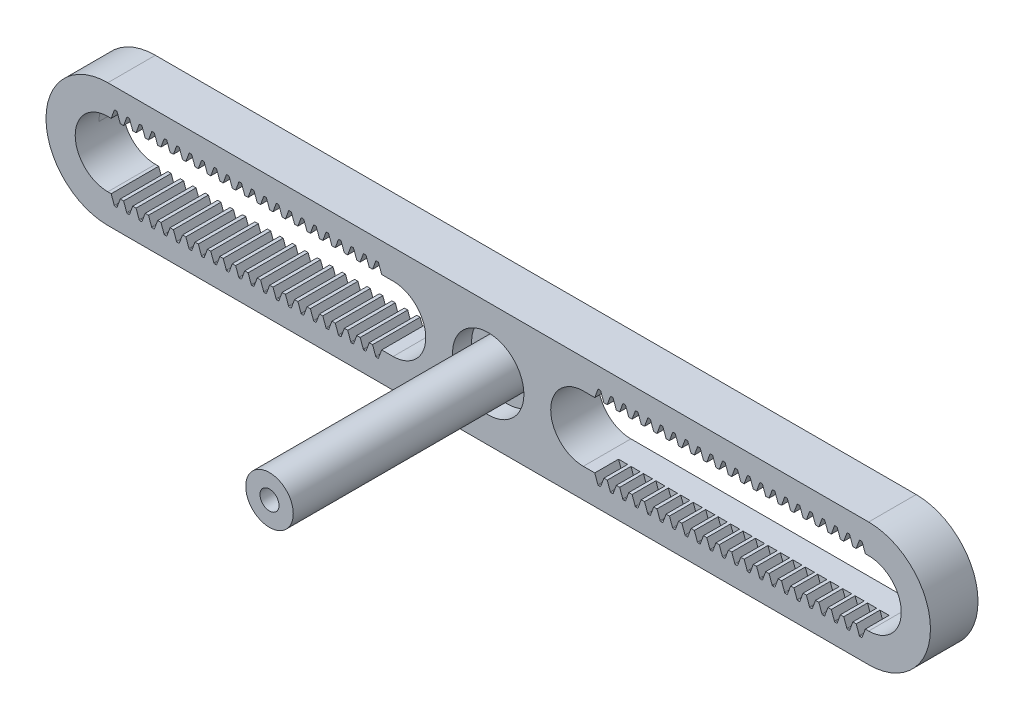
from build123d import *

# Parameters (mm, degrees)
BOSS_EXTRUDE1_DEPTH    = 3.175
SKETCH2_R              = 1.27
CUT_EXTRUDE1_DEPTH     = 50.8
CUT_EXTRUDE2_REACH     = 61.714
FILLET1_R              = 0.09960102
LPATTERN1_COUNT        = 22
LPATTERN1_PITCH        = 1.662439883
FILLET1_OF_LPATTERN1_R = 0.09960102
MIRROR4_DEPTH          = 3.175
MIRROR1_DEPTH          = 3.175
MIRROR2_START          = -3.175
MIRROR2_DEPTH          = 3.175
CUT_EXTRUDE3_DEPTH     = 3.175
MIRROR5_DEPTH          = 3.175
SKETCH6_R              = 4.7625
CUT_EXTRUDE4_DEPTH     = 2.54
BOSS_EXTRUDE2_START    = 31.75
SKETCH7_R              = 3.175
SKETCH7_R_2            = 1.27
BOSS_EXTRUDE2_DEPTH    = 31.75


# Read off the part's stored shape, not the designer's step: Mirror4, Mirror1, Mirror2, Mirror5
with BuildPart() as part:
    # Sketch1 → Boss-Extrude1 (new, symmetric)
    with BuildSketch(Plane.XY):
        with BuildLine():
            Line((-50.8, 8.255), (50.8, 8.255))
            ThreePointArc((50.8, 8.255), (59.055, 0), (50.8, -8.255))
            Line((50.8, -8.255), (-50.8, -8.255))
            ThreePointArc((-50.8, -8.255), (-59.055, 0), (-50.8, 8.255))
        make_face()
    extrude(amount=BOSS_EXTRUDE1_DEPTH, both=True)

    # Sketch2 → Cut-Extrude1 (cut)
    with BuildSketch(Plane.XY.offset(3.175)):
        Circle(SKETCH2_R)
        with BuildLine():
            Line((-50.8, 4.3561), (-12.7, 4.3561))
            ThreePointArc((-12.7, 4.3561), (-8.3439, 0), (-12.7, -4.3561))
            Line((-12.7, -4.3561), (-50.8, -4.3561))
            ThreePointArc((-50.8, -4.3561), (-55.1561, 0), (-50.8, 4.3561))
        make_face()
        with BuildLine():
            Line((50.8, 4.3561), (12.7, 4.3561))
            ThreePointArc((12.7, 4.3561), (8.3439, 0), (12.7, -4.3561))
            Line((12.7, -4.3561), (50.8, -4.3561))
            ThreePointArc((50.8, -4.3561), (55.1561, 0), (50.8, 4.3561))
        make_face()
    extrude(amount=-CUT_EXTRUDE1_DEPTH, mode=Mode.SUBTRACT)

    # Sketch3 → Cut-Extrude2 (cut, up to next)
    with BuildSketch(Plane.XY, mode=Mode.PRIVATE) as cut_extrude2_sk1:
        Polygon((-50.353986922, -4.3561), (-49.91177522, -5.571066667), (-49.57977182, -5.571066667), (-49.137560117, -4.3561), align=None)
    cut_extrude2_tool1 = extrude(cut_extrude2_sk1.sketch, amount=CUT_EXTRUDE2_REACH, mode=Mode.PRIVATE) & part.part
    cut_extrude2 = cut_extrude2_tool1.solids().sort_by_distance((-49.745774, -4.847924, 0))[0]
    add(cut_extrude2, mode=Mode.SUBTRACT)

    # Fillet1
    fillet1_edges = [part.edges().sort_by_distance(p)[0] for p in [
        (-49.91177522, -5.571066667, 1.5875),
        (-49.57977182, -5.571066667, 1.5875),
    ]]
    fillet(fillet1_edges, radius=FILLET1_R)

    # LPattern1: Cut-Extrude2 ×22
    with Locations(*[(i * LPATTERN1_PITCH, 0, 0) for i in range(1, LPATTERN1_COUNT)]):
        add(cut_extrude2, mode=Mode.SUBTRACT)

    # Fillet1 of LPattern1
    fillet1_of_lpattern1_edges = [part.edges().sort_by_distance(p)[0] for p in [
        (-48.249335337, -5.571066667, 1.5875),
        (-47.917331937, -5.571066667, 1.5875),
        (-46.586895455, -5.571066667, 1.5875),
        (-46.254892055, -5.571066667, 1.5875),
        (-44.924455572, -5.571066667, 1.5875),
        (-44.592452172, -5.571066667, 1.5875),
        (-43.262015689, -5.571066667, 1.5875),
        (-42.930012289, -5.571066667, 1.5875),
        (-41.599575807, -5.571066667, 1.5875),
        (-41.267572407, -5.571066667, 1.5875),
        (-39.937135924, -5.571066667, 1.5875),
        (-39.605132524, -5.571066667, 1.5875),
        (-38.274696042, -5.571066667, 1.5875),
        (-37.942692642, -5.571066667, 1.5875),
        (-36.612256159, -5.571066667, 1.5875),
        (-36.280252759, -5.571066667, 1.5875),
        (-34.949816276, -5.571066667, 1.5875),
        (-34.617812876, -5.571066667, 1.5875),
        (-33.287376394, -5.571066667, 1.5875),
        (-32.955372994, -5.571066667, 1.5875),
        (-31.624936511, -5.571066667, 1.5875),
        (-31.292933111, -5.571066667, 1.5875),
        (-29.962496629, -5.571066667, 1.5875),
        (-29.630493229, -5.571066667, 1.5875),
        (-28.300056746, -5.571066667, 1.5875),
        (-27.968053346, -5.571066667, 1.5875),
        (-26.637616864, -5.571066667, 1.5875),
        (-26.305613464, -5.571066667, 1.5875),
        (-24.975176981, -5.571066667, 1.5875),
        (-24.643173581, -5.571066667, 1.5875),
        (-23.312737098, -5.571066667, 1.5875),
        (-22.980733698, -5.571066667, 1.5875),
        (-21.650297216, -5.571066667, 1.5875),
        (-21.318293816, -5.571066667, 1.5875),
        (-19.987857333, -5.571066667, 1.5875),
        (-19.655853933, -5.571066667, 1.5875),
        (-18.325417451, -5.571066667, 1.5875),
        (-17.993414051, -5.571066667, 1.5875),
        (-16.662977568, -5.571066667, 1.5875),
        (-16.330974168, -5.571066667, 1.5875),
        (-15.000537685, -5.571066667, 1.5875),
        (-14.668534285, -5.571066667, 1.5875),
    ]]
    fillet(fillet1_of_lpattern1_edges, radius=FILLET1_OF_LPATTERN1_R)

    # Mirror4 outline → Mirror4 (cut)
    with BuildSketch(Plane.XY):
        with BuildLine():
            ThreePointArc((14.644681327, -5.505531202), (14.681146872, -5.553054026), (14.73827567, -5.571066667))
            Line((14.73827567, -5.571066667), (14.9307963, -5.571066667))
            ThreePointArc((14.9307963, -5.571066667), (14.987925099, -5.553054026), (15.024390644, -5.505531202))
            Line((15.024390644, -5.505531202), (15.442749388, -4.3561))
            Line((15.442749388, -4.3561), (14.226322583, -4.3561))
            Line((14.226322583, -4.3561), (14.644681327, -5.505531202))
        make_face()
        with BuildLine():
            Line((50.353986922, -4.3561), (49.137560117, -4.3561))
            Line((49.137560117, -4.3561), (49.555918861, -5.505531202))
            ThreePointArc((49.555918861, -5.505531202), (49.592384407, -5.553054026), (49.649513205, -5.571066667))
            Line((49.649513205, -5.571066667), (49.842033835, -5.571066667))
            ThreePointArc((49.842033835, -5.571066667), (49.899162633, -5.553054026), (49.935628178, -5.505531202))
            Line((49.935628178, -5.505531202), (50.353986922, -4.3561))
        make_face()
        with BuildLine():
            Line((48.691547039, -4.3561), (47.475120235, -4.3561))
            Line((47.475120235, -4.3561), (47.893478979, -5.505531202))
            ThreePointArc((47.893478979, -5.505531202), (47.929944524, -5.553054026), (47.987073322, -5.571066667))
            Line((47.987073322, -5.571066667), (48.179593952, -5.571066667))
            ThreePointArc((48.179593952, -5.571066667), (48.23672275, -5.553054026), (48.273188296, -5.505531202))
            Line((48.273188296, -5.505531202), (48.691547039, -4.3561))
        make_face()
        with BuildLine():
            Line((47.029107157, -4.3561), (45.812680352, -4.3561))
            Line((45.812680352, -4.3561), (46.231039096, -5.505531202))
            ThreePointArc((46.231039096, -5.505531202), (46.267504641, -5.553054026), (46.32463344, -5.571066667))
            Line((46.32463344, -5.571066667), (46.51715407, -5.571066667))
            ThreePointArc((46.51715407, -5.571066667), (46.574282868, -5.553054026), (46.610748413, -5.505531202))
            Line((46.610748413, -5.505531202), (47.029107157, -4.3561))
        make_face()
        with BuildLine():
            Line((45.366667274, -4.3561), (44.15024047, -4.3561))
            Line((44.15024047, -4.3561), (44.568599213, -5.505531202))
            ThreePointArc((44.568599213, -5.505531202), (44.605064759, -5.553054026), (44.662193557, -5.571066667))
            Line((44.662193557, -5.571066667), (44.854714187, -5.571066667))
            ThreePointArc((44.854714187, -5.571066667), (44.911842985, -5.553054026), (44.94830853, -5.505531202))
            Line((44.94830853, -5.505531202), (45.366667274, -4.3561))
        make_face()
        with BuildLine():
            Line((43.704227392, -4.3561), (42.487800587, -4.3561))
            Line((42.487800587, -4.3561), (42.906159331, -5.505531202))
            ThreePointArc((42.906159331, -5.505531202), (42.942624876, -5.553054026), (42.999753674, -5.571066667))
            Line((42.999753674, -5.571066667), (43.192274304, -5.571066667))
            ThreePointArc((43.192274304, -5.571066667), (43.249403102, -5.553054026), (43.285868648, -5.505531202))
            Line((43.285868648, -5.505531202), (43.704227392, -4.3561))
        make_face()
        with BuildLine():
            Line((42.041787509, -4.3561), (40.825360704, -4.3561))
            Line((40.825360704, -4.3561), (41.243719448, -5.505531202))
            ThreePointArc((41.243719448, -5.505531202), (41.280184994, -5.553054026), (41.337313792, -5.571066667))
            Line((41.337313792, -5.571066667), (41.529834422, -5.571066667))
            ThreePointArc((41.529834422, -5.571066667), (41.58696322, -5.553054026), (41.623428765, -5.505531202))
            Line((41.623428765, -5.505531202), (42.041787509, -4.3561))
        make_face()
        with BuildLine():
            Line((40.379347626, -4.3561), (39.162920822, -4.3561))
            Line((39.162920822, -4.3561), (39.581279566, -5.505531202))
            ThreePointArc((39.581279566, -5.505531202), (39.617745111, -5.553054026), (39.674873909, -5.571066667))
            Line((39.674873909, -5.571066667), (39.867394539, -5.571066667))
            ThreePointArc((39.867394539, -5.571066667), (39.924523337, -5.553054026), (39.960988883, -5.505531202))
            Line((39.960988883, -5.505531202), (40.379347626, -4.3561))
        make_face()
        with BuildLine():
            Line((38.716907744, -4.3561), (37.500480939, -4.3561))
            Line((37.500480939, -4.3561), (37.918839683, -5.505531202))
            ThreePointArc((37.918839683, -5.505531202), (37.955305229, -5.553054026), (38.012434027, -5.571066667))
            Line((38.012434027, -5.571066667), (38.204954657, -5.571066667))
            ThreePointArc((38.204954657, -5.571066667), (38.262083455, -5.553054026), (38.298549, -5.505531202))
            Line((38.298549, -5.505531202), (38.716907744, -4.3561))
        make_face()
        with BuildLine():
            Line((37.054467861, -4.3561), (35.838041057, -4.3561))
            Line((35.838041057, -4.3561), (36.256399801, -5.505531202))
            ThreePointArc((36.256399801, -5.505531202), (36.292865346, -5.553054026), (36.349994144, -5.571066667))
            Line((36.349994144, -5.571066667), (36.542514774, -5.571066667))
            ThreePointArc((36.542514774, -5.571066667), (36.599643572, -5.553054026), (36.636109118, -5.505531202))
            Line((36.636109118, -5.505531202), (37.054467861, -4.3561))
        make_face()
        with BuildLine():
            Line((35.392027979, -4.3561), (34.175601174, -4.3561))
            Line((34.175601174, -4.3561), (34.593959918, -5.505531202))
            ThreePointArc((34.593959918, -5.505531202), (34.630425463, -5.553054026), (34.687554261, -5.571066667))
            Line((34.687554261, -5.571066667), (34.880074891, -5.571066667))
            ThreePointArc((34.880074891, -5.571066667), (34.93720369, -5.553054026), (34.973669235, -5.505531202))
            Line((34.973669235, -5.505531202), (35.392027979, -4.3561))
        make_face()
        with BuildLine():
            Line((33.729588096, -4.3561), (32.513161292, -4.3561))
            Line((32.513161292, -4.3561), (32.931520035, -5.505531202))
            ThreePointArc((32.931520035, -5.505531202), (32.967985581, -5.553054026), (33.025114379, -5.571066667))
            Line((33.025114379, -5.571066667), (33.217635009, -5.571066667))
            ThreePointArc((33.217635009, -5.571066667), (33.274763807, -5.553054026), (33.311229352, -5.505531202))
            Line((33.311229352, -5.505531202), (33.729588096, -4.3561))
        make_face()
        with BuildLine():
            Line((32.067148214, -4.3561), (30.850721409, -4.3561))
            Line((30.850721409, -4.3561), (31.269080153, -5.505531202))
            ThreePointArc((31.269080153, -5.505531202), (31.305545698, -5.553054026), (31.362674496, -5.571066667))
            Line((31.362674496, -5.571066667), (31.555195126, -5.571066667))
            ThreePointArc((31.555195126, -5.571066667), (31.612323924, -5.553054026), (31.64878947, -5.505531202))
            Line((31.64878947, -5.505531202), (32.067148214, -4.3561))
        make_face()
        with BuildLine():
            Line((30.404708331, -4.3561), (29.188281526, -4.3561))
            Line((29.188281526, -4.3561), (29.60664027, -5.505531202))
            ThreePointArc((29.60664027, -5.505531202), (29.643105816, -5.553054026), (29.700234614, -5.571066667))
            Line((29.700234614, -5.571066667), (29.892755244, -5.571066667))
            ThreePointArc((29.892755244, -5.571066667), (29.949884042, -5.553054026), (29.986349587, -5.505531202))
            Line((29.986349587, -5.505531202), (30.404708331, -4.3561))
        make_face()
        with BuildLine():
            Line((28.742268448, -4.3561), (27.525841644, -4.3561))
            Line((27.525841644, -4.3561), (27.944200388, -5.505531202))
            ThreePointArc((27.944200388, -5.505531202), (27.980665933, -5.553054026), (28.037794731, -5.571066667))
            Line((28.037794731, -5.571066667), (28.230315361, -5.571066667))
            ThreePointArc((28.230315361, -5.571066667), (28.287444159, -5.553054026), (28.323909705, -5.505531202))
            Line((28.323909705, -5.505531202), (28.742268448, -4.3561))
        make_face()
        with BuildLine():
            Line((27.079828566, -4.3561), (25.863401761, -4.3561))
            Line((25.863401761, -4.3561), (26.281760505, -5.505531202))
            ThreePointArc((26.281760505, -5.505531202), (26.31822605, -5.553054026), (26.375354849, -5.571066667))
            Line((26.375354849, -5.571066667), (26.567875479, -5.571066667))
            ThreePointArc((26.567875479, -5.571066667), (26.625004277, -5.553054026), (26.661469822, -5.505531202))
            Line((26.661469822, -5.505531202), (27.079828566, -4.3561))
        make_face()
        with BuildLine():
            Line((25.417388683, -4.3561), (24.200961879, -4.3561))
            Line((24.200961879, -4.3561), (24.619320622, -5.505531202))
            ThreePointArc((24.619320622, -5.505531202), (24.655786168, -5.553054026), (24.712914966, -5.571066667))
            Line((24.712914966, -5.571066667), (24.905435596, -5.571066667))
            ThreePointArc((24.905435596, -5.571066667), (24.962564394, -5.553054026), (24.999029939, -5.505531202))
            Line((24.999029939, -5.505531202), (25.417388683, -4.3561))
        make_face()
        with BuildLine():
            Line((23.754948801, -4.3561), (22.538521996, -4.3561))
            Line((22.538521996, -4.3561), (22.95688074, -5.505531202))
            ThreePointArc((22.95688074, -5.505531202), (22.993346285, -5.553054026), (23.050475083, -5.571066667))
            Line((23.050475083, -5.571066667), (23.242995713, -5.571066667))
            ThreePointArc((23.242995713, -5.571066667), (23.300124511, -5.553054026), (23.336590057, -5.505531202))
            Line((23.336590057, -5.505531202), (23.754948801, -4.3561))
        make_face()
        with BuildLine():
            Line((22.092508918, -4.3561), (20.876082113, -4.3561))
            Line((20.876082113, -4.3561), (21.294440857, -5.505531202))
            ThreePointArc((21.294440857, -5.505531202), (21.330906403, -5.553054026), (21.388035201, -5.571066667))
            Line((21.388035201, -5.571066667), (21.580555831, -5.571066667))
            ThreePointArc((21.580555831, -5.571066667), (21.637684629, -5.553054026), (21.674150174, -5.505531202))
            Line((21.674150174, -5.505531202), (22.092508918, -4.3561))
        make_face()
        with BuildLine():
            Line((20.430069035, -4.3561), (19.213642231, -4.3561))
            Line((19.213642231, -4.3561), (19.632000975, -5.505531202))
            ThreePointArc((19.632000975, -5.505531202), (19.66846652, -5.553054026), (19.725595318, -5.571066667))
            Line((19.725595318, -5.571066667), (19.918115948, -5.571066667))
            ThreePointArc((19.918115948, -5.571066667), (19.975244746, -5.553054026), (20.011710292, -5.505531202))
            Line((20.011710292, -5.505531202), (20.430069035, -4.3561))
        make_face()
        with BuildLine():
            Line((18.767629153, -4.3561), (17.551202348, -4.3561))
            Line((17.551202348, -4.3561), (17.969561092, -5.505531202))
            ThreePointArc((17.969561092, -5.505531202), (18.006026638, -5.553054026), (18.063155436, -5.571066667))
            Line((18.063155436, -5.571066667), (18.255676066, -5.571066667))
            ThreePointArc((18.255676066, -5.571066667), (18.312804864, -5.553054026), (18.349270409, -5.505531202))
            Line((18.349270409, -5.505531202), (18.767629153, -4.3561))
        make_face()
        with BuildLine():
            Line((17.10518927, -4.3561), (15.888762466, -4.3561))
            Line((15.888762466, -4.3561), (16.30712121, -5.505531202))
            ThreePointArc((16.30712121, -5.505531202), (16.343586755, -5.553054026), (16.400715553, -5.571066667))
            Line((16.400715553, -5.571066667), (16.593236183, -5.571066667))
            ThreePointArc((16.593236183, -5.571066667), (16.650364981, -5.553054026), (16.686830527, -5.505531202))
            Line((16.686830527, -5.505531202), (17.10518927, -4.3561))
        make_face()
    extrude(amount=MIRROR4_DEPTH, mode=Mode.SUBTRACT)

    # Mirror1 outline → Mirror1 (cut)
    with BuildSketch(Plane.XY):
        with BuildLine():
            Line((-15.442749388, 4.3561), (-14.226322583, 4.3561))
            Line((-14.226322583, 4.3561), (-14.644681327, 5.505531202))
            ThreePointArc((-14.644681327, 5.505531202), (-14.681146872, 5.553054026), (-14.73827567, 5.571066667))
            Line((-14.73827567, 5.571066667), (-14.9307963, 5.571066667))
            ThreePointArc((-14.9307963, 5.571066667), (-14.987925099, 5.553054026), (-15.024390644, 5.505531202))
            Line((-15.024390644, 5.505531202), (-15.442749388, 4.3561))
        make_face()
        with BuildLine():
            Line((-50.353986922, 4.3561), (-49.137560117, 4.3561))
            Line((-49.137560117, 4.3561), (-49.555918861, 5.505531202))
            ThreePointArc((-49.555918861, 5.505531202), (-49.592384407, 5.553054026), (-49.649513205, 5.571066667))
            Line((-49.649513205, 5.571066667), (-49.842033835, 5.571066667))
            ThreePointArc((-49.842033835, 5.571066667), (-49.899162633, 5.553054026), (-49.935628178, 5.505531202))
            Line((-49.935628178, 5.505531202), (-50.353986922, 4.3561))
        make_face()
        with BuildLine():
            Line((-48.691547039, 4.3561), (-47.475120235, 4.3561))
            Line((-47.475120235, 4.3561), (-47.893478979, 5.505531202))
            ThreePointArc((-47.893478979, 5.505531202), (-47.929944524, 5.553054026), (-47.987073322, 5.571066667))
            Line((-47.987073322, 5.571066667), (-48.179593952, 5.571066667))
            ThreePointArc((-48.179593952, 5.571066667), (-48.23672275, 5.553054026), (-48.273188296, 5.505531202))
            Line((-48.273188296, 5.505531202), (-48.691547039, 4.3561))
        make_face()
        with BuildLine():
            Line((-47.029107157, 4.3561), (-45.812680352, 4.3561))
            Line((-45.812680352, 4.3561), (-46.231039096, 5.505531202))
            ThreePointArc((-46.231039096, 5.505531202), (-46.267504641, 5.553054026), (-46.32463344, 5.571066667))
            Line((-46.32463344, 5.571066667), (-46.51715407, 5.571066667))
            ThreePointArc((-46.51715407, 5.571066667), (-46.574282868, 5.553054026), (-46.610748413, 5.505531202))
            Line((-46.610748413, 5.505531202), (-47.029107157, 4.3561))
        make_face()
        with BuildLine():
            Line((-45.366667274, 4.3561), (-44.15024047, 4.3561))
            Line((-44.15024047, 4.3561), (-44.568599213, 5.505531202))
            ThreePointArc((-44.568599213, 5.505531202), (-44.605064759, 5.553054026), (-44.662193557, 5.571066667))
            Line((-44.662193557, 5.571066667), (-44.854714187, 5.571066667))
            ThreePointArc((-44.854714187, 5.571066667), (-44.911842985, 5.553054026), (-44.94830853, 5.505531202))
            Line((-44.94830853, 5.505531202), (-45.366667274, 4.3561))
        make_face()
        with BuildLine():
            Line((-43.704227392, 4.3561), (-42.487800587, 4.3561))
            Line((-42.487800587, 4.3561), (-42.906159331, 5.505531202))
            ThreePointArc((-42.906159331, 5.505531202), (-42.942624876, 5.553054026), (-42.999753674, 5.571066667))
            Line((-42.999753674, 5.571066667), (-43.192274304, 5.571066667))
            ThreePointArc((-43.192274304, 5.571066667), (-43.249403102, 5.553054026), (-43.285868648, 5.505531202))
            Line((-43.285868648, 5.505531202), (-43.704227392, 4.3561))
        make_face()
        with BuildLine():
            Line((-42.041787509, 4.3561), (-40.825360704, 4.3561))
            Line((-40.825360704, 4.3561), (-41.243719448, 5.505531202))
            ThreePointArc((-41.243719448, 5.505531202), (-41.280184994, 5.553054026), (-41.337313792, 5.571066667))
            Line((-41.337313792, 5.571066667), (-41.529834422, 5.571066667))
            ThreePointArc((-41.529834422, 5.571066667), (-41.58696322, 5.553054026), (-41.623428765, 5.505531202))
            Line((-41.623428765, 5.505531202), (-42.041787509, 4.3561))
        make_face()
        with BuildLine():
            Line((-40.379347626, 4.3561), (-39.162920822, 4.3561))
            Line((-39.162920822, 4.3561), (-39.581279566, 5.505531202))
            ThreePointArc((-39.581279566, 5.505531202), (-39.617745111, 5.553054026), (-39.674873909, 5.571066667))
            Line((-39.674873909, 5.571066667), (-39.867394539, 5.571066667))
            ThreePointArc((-39.867394539, 5.571066667), (-39.924523337, 5.553054026), (-39.960988883, 5.505531202))
            Line((-39.960988883, 5.505531202), (-40.379347626, 4.3561))
        make_face()
        with BuildLine():
            Line((-38.716907744, 4.3561), (-37.500480939, 4.3561))
            Line((-37.500480939, 4.3561), (-37.918839683, 5.505531202))
            ThreePointArc((-37.918839683, 5.505531202), (-37.955305229, 5.553054026), (-38.012434027, 5.571066667))
            Line((-38.012434027, 5.571066667), (-38.204954657, 5.571066667))
            ThreePointArc((-38.204954657, 5.571066667), (-38.262083455, 5.553054026), (-38.298549, 5.505531202))
            Line((-38.298549, 5.505531202), (-38.716907744, 4.3561))
        make_face()
        with BuildLine():
            Line((-37.054467861, 4.3561), (-35.838041057, 4.3561))
            Line((-35.838041057, 4.3561), (-36.256399801, 5.505531202))
            ThreePointArc((-36.256399801, 5.505531202), (-36.292865346, 5.553054026), (-36.349994144, 5.571066667))
            Line((-36.349994144, 5.571066667), (-36.542514774, 5.571066667))
            ThreePointArc((-36.542514774, 5.571066667), (-36.599643572, 5.553054026), (-36.636109118, 5.505531202))
            Line((-36.636109118, 5.505531202), (-37.054467861, 4.3561))
        make_face()
        with BuildLine():
            Line((-35.392027979, 4.3561), (-34.175601174, 4.3561))
            Line((-34.175601174, 4.3561), (-34.593959918, 5.505531202))
            ThreePointArc((-34.593959918, 5.505531202), (-34.630425463, 5.553054026), (-34.687554261, 5.571066667))
            Line((-34.687554261, 5.571066667), (-34.880074891, 5.571066667))
            ThreePointArc((-34.880074891, 5.571066667), (-34.93720369, 5.553054026), (-34.973669235, 5.505531202))
            Line((-34.973669235, 5.505531202), (-35.392027979, 4.3561))
        make_face()
        with BuildLine():
            Line((-33.729588096, 4.3561), (-32.513161292, 4.3561))
            Line((-32.513161292, 4.3561), (-32.931520035, 5.505531202))
            ThreePointArc((-32.931520035, 5.505531202), (-32.967985581, 5.553054026), (-33.025114379, 5.571066667))
            Line((-33.025114379, 5.571066667), (-33.217635009, 5.571066667))
            ThreePointArc((-33.217635009, 5.571066667), (-33.274763807, 5.553054026), (-33.311229352, 5.505531202))
            Line((-33.311229352, 5.505531202), (-33.729588096, 4.3561))
        make_face()
        with BuildLine():
            Line((-32.067148214, 4.3561), (-30.850721409, 4.3561))
            Line((-30.850721409, 4.3561), (-31.269080153, 5.505531202))
            ThreePointArc((-31.269080153, 5.505531202), (-31.305545698, 5.553054026), (-31.362674496, 5.571066667))
            Line((-31.362674496, 5.571066667), (-31.555195126, 5.571066667))
            ThreePointArc((-31.555195126, 5.571066667), (-31.612323924, 5.553054026), (-31.64878947, 5.505531202))
            Line((-31.64878947, 5.505531202), (-32.067148214, 4.3561))
        make_face()
        with BuildLine():
            Line((-30.404708331, 4.3561), (-29.188281526, 4.3561))
            Line((-29.188281526, 4.3561), (-29.60664027, 5.505531202))
            ThreePointArc((-29.60664027, 5.505531202), (-29.643105816, 5.553054026), (-29.700234614, 5.571066667))
            Line((-29.700234614, 5.571066667), (-29.892755244, 5.571066667))
            ThreePointArc((-29.892755244, 5.571066667), (-29.949884042, 5.553054026), (-29.986349587, 5.505531202))
            Line((-29.986349587, 5.505531202), (-30.404708331, 4.3561))
        make_face()
        with BuildLine():
            Line((-28.742268448, 4.3561), (-27.525841644, 4.3561))
            Line((-27.525841644, 4.3561), (-27.944200388, 5.505531202))
            ThreePointArc((-27.944200388, 5.505531202), (-27.980665933, 5.553054026), (-28.037794731, 5.571066667))
            Line((-28.037794731, 5.571066667), (-28.230315361, 5.571066667))
            ThreePointArc((-28.230315361, 5.571066667), (-28.287444159, 5.553054026), (-28.323909705, 5.505531202))
            Line((-28.323909705, 5.505531202), (-28.742268448, 4.3561))
        make_face()
        with BuildLine():
            Line((-27.079828566, 4.3561), (-25.863401761, 4.3561))
            Line((-25.863401761, 4.3561), (-26.281760505, 5.505531202))
            ThreePointArc((-26.281760505, 5.505531202), (-26.31822605, 5.553054026), (-26.375354849, 5.571066667))
            Line((-26.375354849, 5.571066667), (-26.567875479, 5.571066667))
            ThreePointArc((-26.567875479, 5.571066667), (-26.625004277, 5.553054026), (-26.661469822, 5.505531202))
            Line((-26.661469822, 5.505531202), (-27.079828566, 4.3561))
        make_face()
        with BuildLine():
            Line((-25.417388683, 4.3561), (-24.200961879, 4.3561))
            Line((-24.200961879, 4.3561), (-24.619320622, 5.505531202))
            ThreePointArc((-24.619320622, 5.505531202), (-24.655786168, 5.553054026), (-24.712914966, 5.571066667))
            Line((-24.712914966, 5.571066667), (-24.905435596, 5.571066667))
            ThreePointArc((-24.905435596, 5.571066667), (-24.962564394, 5.553054026), (-24.999029939, 5.505531202))
            Line((-24.999029939, 5.505531202), (-25.417388683, 4.3561))
        make_face()
        with BuildLine():
            Line((-23.754948801, 4.3561), (-22.538521996, 4.3561))
            Line((-22.538521996, 4.3561), (-22.95688074, 5.505531202))
            ThreePointArc((-22.95688074, 5.505531202), (-22.993346285, 5.553054026), (-23.050475083, 5.571066667))
            Line((-23.050475083, 5.571066667), (-23.242995713, 5.571066667))
            ThreePointArc((-23.242995713, 5.571066667), (-23.300124511, 5.553054026), (-23.336590057, 5.505531202))
            Line((-23.336590057, 5.505531202), (-23.754948801, 4.3561))
        make_face()
        with BuildLine():
            Line((-22.092508918, 4.3561), (-20.876082113, 4.3561))
            Line((-20.876082113, 4.3561), (-21.294440857, 5.505531202))
            ThreePointArc((-21.294440857, 5.505531202), (-21.330906403, 5.553054026), (-21.388035201, 5.571066667))
            Line((-21.388035201, 5.571066667), (-21.580555831, 5.571066667))
            ThreePointArc((-21.580555831, 5.571066667), (-21.637684629, 5.553054026), (-21.674150174, 5.505531202))
            Line((-21.674150174, 5.505531202), (-22.092508918, 4.3561))
        make_face()
        with BuildLine():
            Line((-20.430069035, 4.3561), (-19.213642231, 4.3561))
            Line((-19.213642231, 4.3561), (-19.632000975, 5.505531202))
            ThreePointArc((-19.632000975, 5.505531202), (-19.66846652, 5.553054026), (-19.725595318, 5.571066667))
            Line((-19.725595318, 5.571066667), (-19.918115948, 5.571066667))
            ThreePointArc((-19.918115948, 5.571066667), (-19.975244746, 5.553054026), (-20.011710292, 5.505531202))
            Line((-20.011710292, 5.505531202), (-20.430069035, 4.3561))
        make_face()
        with BuildLine():
            Line((-18.767629153, 4.3561), (-17.551202348, 4.3561))
            Line((-17.551202348, 4.3561), (-17.969561092, 5.505531202))
            ThreePointArc((-17.969561092, 5.505531202), (-18.006026638, 5.553054026), (-18.063155436, 5.571066667))
            Line((-18.063155436, 5.571066667), (-18.255676066, 5.571066667))
            ThreePointArc((-18.255676066, 5.571066667), (-18.312804864, 5.553054026), (-18.349270409, 5.505531202))
            Line((-18.349270409, 5.505531202), (-18.767629153, 4.3561))
        make_face()
        with BuildLine():
            Line((-17.10518927, 4.3561), (-15.888762466, 4.3561))
            Line((-15.888762466, 4.3561), (-16.30712121, 5.505531202))
            ThreePointArc((-16.30712121, 5.505531202), (-16.343586755, 5.553054026), (-16.400715553, 5.571066667))
            Line((-16.400715553, 5.571066667), (-16.593236183, 5.571066667))
            ThreePointArc((-16.593236183, 5.571066667), (-16.650364981, 5.553054026), (-16.686830527, 5.505531202))
            Line((-16.686830527, 5.505531202), (-17.10518927, 4.3561))
        make_face()
    extrude(amount=MIRROR1_DEPTH, mode=Mode.SUBTRACT)

    # Mirror2 outline → Mirror2 (cut)
    with BuildSketch(Plane.XY.offset(MIRROR2_START)):
        with BuildLine():
            Line((-14.226322583, -4.3561), (-15.442749388, -4.3561))
            Line((-15.442749388, -4.3561), (-15.024390644, -5.505531202))
            ThreePointArc((-15.024390644, -5.505531202), (-14.987925099, -5.553054026), (-14.9307963, -5.571066667))
            Line((-14.9307963, -5.571066667), (-14.73827567, -5.571066667))
            ThreePointArc((-14.73827567, -5.571066667), (-14.681146872, -5.553054026), (-14.644681327, -5.505531202))
            Line((-14.644681327, -5.505531202), (-14.226322583, -4.3561))
        make_face()
        with BuildLine():
            Line((-15.888762466, -4.3561), (-17.10518927, -4.3561))
            Line((-17.10518927, -4.3561), (-16.686830527, -5.505531202))
            ThreePointArc((-16.686830527, -5.505531202), (-16.650364981, -5.553054026), (-16.593236183, -5.571066667))
            Line((-16.593236183, -5.571066667), (-16.400715553, -5.571066667))
            ThreePointArc((-16.400715553, -5.571066667), (-16.343586755, -5.553054026), (-16.30712121, -5.505531202))
            Line((-16.30712121, -5.505531202), (-15.888762466, -4.3561))
        make_face()
        with BuildLine():
            Line((-17.551202348, -4.3561), (-18.767629153, -4.3561))
            Line((-18.767629153, -4.3561), (-18.349270409, -5.505531202))
            ThreePointArc((-18.349270409, -5.505531202), (-18.312804864, -5.553054026), (-18.255676066, -5.571066667))
            Line((-18.255676066, -5.571066667), (-18.063155436, -5.571066667))
            ThreePointArc((-18.063155436, -5.571066667), (-18.006026638, -5.553054026), (-17.969561092, -5.505531202))
            Line((-17.969561092, -5.505531202), (-17.551202348, -4.3561))
        make_face()
        with BuildLine():
            Line((-19.213642231, -4.3561), (-20.430069035, -4.3561))
            Line((-20.430069035, -4.3561), (-20.011710292, -5.505531202))
            ThreePointArc((-20.011710292, -5.505531202), (-19.975244746, -5.553054026), (-19.918115948, -5.571066667))
            Line((-19.918115948, -5.571066667), (-19.725595318, -5.571066667))
            ThreePointArc((-19.725595318, -5.571066667), (-19.66846652, -5.553054026), (-19.632000975, -5.505531202))
            Line((-19.632000975, -5.505531202), (-19.213642231, -4.3561))
        make_face()
        with BuildLine():
            Line((-20.876082113, -4.3561), (-22.092508918, -4.3561))
            Line((-22.092508918, -4.3561), (-21.674150174, -5.505531202))
            ThreePointArc((-21.674150174, -5.505531202), (-21.637684629, -5.553054026), (-21.580555831, -5.571066667))
            Line((-21.580555831, -5.571066667), (-21.388035201, -5.571066667))
            ThreePointArc((-21.388035201, -5.571066667), (-21.330906403, -5.553054026), (-21.294440857, -5.505531202))
            Line((-21.294440857, -5.505531202), (-20.876082113, -4.3561))
        make_face()
        with BuildLine():
            Line((-22.538521996, -4.3561), (-23.754948801, -4.3561))
            Line((-23.754948801, -4.3561), (-23.336590057, -5.505531202))
            ThreePointArc((-23.336590057, -5.505531202), (-23.300124511, -5.553054026), (-23.242995713, -5.571066667))
            Line((-23.242995713, -5.571066667), (-23.050475083, -5.571066667))
            ThreePointArc((-23.050475083, -5.571066667), (-22.993346285, -5.553054026), (-22.95688074, -5.505531202))
            Line((-22.95688074, -5.505531202), (-22.538521996, -4.3561))
        make_face()
        with BuildLine():
            Line((-24.200961879, -4.3561), (-25.417388683, -4.3561))
            Line((-25.417388683, -4.3561), (-24.999029939, -5.505531202))
            ThreePointArc((-24.999029939, -5.505531202), (-24.962564394, -5.553054026), (-24.905435596, -5.571066667))
            Line((-24.905435596, -5.571066667), (-24.712914966, -5.571066667))
            ThreePointArc((-24.712914966, -5.571066667), (-24.655786168, -5.553054026), (-24.619320622, -5.505531202))
            Line((-24.619320622, -5.505531202), (-24.200961879, -4.3561))
        make_face()
        with BuildLine():
            Line((-25.863401761, -4.3561), (-27.079828566, -4.3561))
            Line((-27.079828566, -4.3561), (-26.661469822, -5.505531202))
            ThreePointArc((-26.661469822, -5.505531202), (-26.625004277, -5.553054026), (-26.567875479, -5.571066667))
            Line((-26.567875479, -5.571066667), (-26.375354849, -5.571066667))
            ThreePointArc((-26.375354849, -5.571066667), (-26.31822605, -5.553054026), (-26.281760505, -5.505531202))
            Line((-26.281760505, -5.505531202), (-25.863401761, -4.3561))
        make_face()
        with BuildLine():
            Line((-27.525841644, -4.3561), (-28.742268448, -4.3561))
            Line((-28.742268448, -4.3561), (-28.323909705, -5.505531202))
            ThreePointArc((-28.323909705, -5.505531202), (-28.287444159, -5.553054026), (-28.230315361, -5.571066667))
            Line((-28.230315361, -5.571066667), (-28.037794731, -5.571066667))
            ThreePointArc((-28.037794731, -5.571066667), (-27.980665933, -5.553054026), (-27.944200388, -5.505531202))
            Line((-27.944200388, -5.505531202), (-27.525841644, -4.3561))
        make_face()
        with BuildLine():
            Line((-29.188281526, -4.3561), (-30.404708331, -4.3561))
            Line((-30.404708331, -4.3561), (-29.986349587, -5.505531202))
            ThreePointArc((-29.986349587, -5.505531202), (-29.949884042, -5.553054026), (-29.892755244, -5.571066667))
            Line((-29.892755244, -5.571066667), (-29.700234614, -5.571066667))
            ThreePointArc((-29.700234614, -5.571066667), (-29.643105816, -5.553054026), (-29.60664027, -5.505531202))
            Line((-29.60664027, -5.505531202), (-29.188281526, -4.3561))
        make_face()
        with BuildLine():
            Line((-30.850721409, -4.3561), (-32.067148214, -4.3561))
            Line((-32.067148214, -4.3561), (-31.64878947, -5.505531202))
            ThreePointArc((-31.64878947, -5.505531202), (-31.612323924, -5.553054026), (-31.555195126, -5.571066667))
            Line((-31.555195126, -5.571066667), (-31.362674496, -5.571066667))
            ThreePointArc((-31.362674496, -5.571066667), (-31.305545698, -5.553054026), (-31.269080153, -5.505531202))
            Line((-31.269080153, -5.505531202), (-30.850721409, -4.3561))
        make_face()
        with BuildLine():
            Line((-32.513161292, -4.3561), (-33.729588096, -4.3561))
            Line((-33.729588096, -4.3561), (-33.311229352, -5.505531202))
            ThreePointArc((-33.311229352, -5.505531202), (-33.274763807, -5.553054026), (-33.217635009, -5.571066667))
            Line((-33.217635009, -5.571066667), (-33.025114379, -5.571066667))
            ThreePointArc((-33.025114379, -5.571066667), (-32.967985581, -5.553054026), (-32.931520035, -5.505531202))
            Line((-32.931520035, -5.505531202), (-32.513161292, -4.3561))
        make_face()
        with BuildLine():
            Line((-34.175601174, -4.3561), (-35.392027979, -4.3561))
            Line((-35.392027979, -4.3561), (-34.973669235, -5.505531202))
            ThreePointArc((-34.973669235, -5.505531202), (-34.93720369, -5.553054026), (-34.880074891, -5.571066667))
            Line((-34.880074891, -5.571066667), (-34.687554261, -5.571066667))
            ThreePointArc((-34.687554261, -5.571066667), (-34.630425463, -5.553054026), (-34.593959918, -5.505531202))
            Line((-34.593959918, -5.505531202), (-34.175601174, -4.3561))
        make_face()
        with BuildLine():
            Line((-35.838041057, -4.3561), (-37.054467861, -4.3561))
            Line((-37.054467861, -4.3561), (-36.636109118, -5.505531202))
            ThreePointArc((-36.636109118, -5.505531202), (-36.599643572, -5.553054026), (-36.542514774, -5.571066667))
            Line((-36.542514774, -5.571066667), (-36.349994144, -5.571066667))
            ThreePointArc((-36.349994144, -5.571066667), (-36.292865346, -5.553054026), (-36.256399801, -5.505531202))
            Line((-36.256399801, -5.505531202), (-35.838041057, -4.3561))
        make_face()
        with BuildLine():
            Line((-37.500480939, -4.3561), (-38.716907744, -4.3561))
            Line((-38.716907744, -4.3561), (-38.298549, -5.505531202))
            ThreePointArc((-38.298549, -5.505531202), (-38.262083455, -5.553054026), (-38.204954657, -5.571066667))
            Line((-38.204954657, -5.571066667), (-38.012434027, -5.571066667))
            ThreePointArc((-38.012434027, -5.571066667), (-37.955305229, -5.553054026), (-37.918839683, -5.505531202))
            Line((-37.918839683, -5.505531202), (-37.500480939, -4.3561))
        make_face()
        with BuildLine():
            Line((-39.162920822, -4.3561), (-40.379347626, -4.3561))
            Line((-40.379347626, -4.3561), (-39.960988883, -5.505531202))
            ThreePointArc((-39.960988883, -5.505531202), (-39.924523337, -5.553054026), (-39.867394539, -5.571066667))
            Line((-39.867394539, -5.571066667), (-39.674873909, -5.571066667))
            ThreePointArc((-39.674873909, -5.571066667), (-39.617745111, -5.553054026), (-39.581279566, -5.505531202))
            Line((-39.581279566, -5.505531202), (-39.162920822, -4.3561))
        make_face()
        with BuildLine():
            Line((-40.825360704, -4.3561), (-42.041787509, -4.3561))
            Line((-42.041787509, -4.3561), (-41.623428765, -5.505531202))
            ThreePointArc((-41.623428765, -5.505531202), (-41.58696322, -5.553054026), (-41.529834422, -5.571066667))
            Line((-41.529834422, -5.571066667), (-41.337313792, -5.571066667))
            ThreePointArc((-41.337313792, -5.571066667), (-41.280184994, -5.553054026), (-41.243719448, -5.505531202))
            Line((-41.243719448, -5.505531202), (-40.825360704, -4.3561))
        make_face()
        with BuildLine():
            Line((-42.487800587, -4.3561), (-43.704227392, -4.3561))
            Line((-43.704227392, -4.3561), (-43.285868648, -5.505531202))
            ThreePointArc((-43.285868648, -5.505531202), (-43.249403102, -5.553054026), (-43.192274304, -5.571066667))
            Line((-43.192274304, -5.571066667), (-42.999753674, -5.571066667))
            ThreePointArc((-42.999753674, -5.571066667), (-42.942624876, -5.553054026), (-42.906159331, -5.505531202))
            Line((-42.906159331, -5.505531202), (-42.487800587, -4.3561))
        make_face()
        with BuildLine():
            Line((-44.15024047, -4.3561), (-45.366667274, -4.3561))
            Line((-45.366667274, -4.3561), (-44.94830853, -5.505531202))
            ThreePointArc((-44.94830853, -5.505531202), (-44.911842985, -5.553054026), (-44.854714187, -5.571066667))
            Line((-44.854714187, -5.571066667), (-44.662193557, -5.571066667))
            ThreePointArc((-44.662193557, -5.571066667), (-44.605064759, -5.553054026), (-44.568599213, -5.505531202))
            Line((-44.568599213, -5.505531202), (-44.15024047, -4.3561))
        make_face()
        with BuildLine():
            Line((-45.812680352, -4.3561), (-47.029107157, -4.3561))
            Line((-47.029107157, -4.3561), (-46.610748413, -5.505531202))
            ThreePointArc((-46.610748413, -5.505531202), (-46.574282868, -5.553054026), (-46.51715407, -5.571066667))
            Line((-46.51715407, -5.571066667), (-46.32463344, -5.571066667))
            ThreePointArc((-46.32463344, -5.571066667), (-46.267504641, -5.553054026), (-46.231039096, -5.505531202))
            Line((-46.231039096, -5.505531202), (-45.812680352, -4.3561))
        make_face()
        with BuildLine():
            Line((-47.475120235, -4.3561), (-48.691547039, -4.3561))
            Line((-48.691547039, -4.3561), (-48.273188296, -5.505531202))
            ThreePointArc((-48.273188296, -5.505531202), (-48.23672275, -5.553054026), (-48.179593952, -5.571066667))
            Line((-48.179593952, -5.571066667), (-47.987073322, -5.571066667))
            ThreePointArc((-47.987073322, -5.571066667), (-47.929944524, -5.553054026), (-47.893478979, -5.505531202))
            Line((-47.893478979, -5.505531202), (-47.475120235, -4.3561))
        make_face()
        with BuildLine():
            Line((-50.353986922, -4.3561), (-49.935628178, -5.505531202))
            ThreePointArc((-49.935628178, -5.505531202), (-49.899162633, -5.553054026), (-49.842033835, -5.571066667))
            Line((-49.842033835, -5.571066667), (-49.649513205, -5.571066667))
            ThreePointArc((-49.649513205, -5.571066667), (-49.592384407, -5.553054026), (-49.555918861, -5.505531202))
            Line((-49.555918861, -5.505531202), (-49.137560117, -4.3561))
            Line((-49.137560117, -4.3561), (-50.353986922, -4.3561))
        make_face()
    extrude(amount=MIRROR2_DEPTH, mode=Mode.SUBTRACT)

    # Sketch5 → Cut-Extrude3 (cut)
    with BuildSketch(Plane(origin=(0, 0, -3.175), x_dir=(-1, 0, 0), z_dir=(0, 0, -1))):
        with BuildLine():
            Line((13.9319, 5.588), (49.5681, 5.588))
            ThreePointArc((49.5681, 5.588), (53.519412693, 3.951312693), (55.1561, 0))
            Line((55.1561, 0), (8.3439, 0))
            ThreePointArc((8.3439, 0), (9.980587307, 3.951312693), (13.9319, 5.588))
        make_face()
    extrude(amount=-CUT_EXTRUDE3_DEPTH, mode=Mode.SUBTRACT)

    # Mirror5 outline → Mirror5 (cut)
    with BuildSketch(Plane.XY):
        with BuildLine():
            Line((49.555918861, 5.505531202), (49.137560117, 4.3561))
            Line((49.137560117, 4.3561), (50.353986922, 4.3561))
            Line((50.353986922, 4.3561), (49.935628178, 5.505531202))
            ThreePointArc((49.935628178, 5.505531202), (49.899162633, 5.553054026), (49.842033835, 5.571066667))
            Line((49.842033835, 5.571066667), (49.649513205, 5.571066667))
            ThreePointArc((49.649513205, 5.571066667), (49.592384407, 5.553054026), (49.555918861, 5.505531202))
        make_face()
        with BuildLine():
            Line((47.893478979, 5.505531202), (47.475120235, 4.3561))
            Line((47.475120235, 4.3561), (48.691547039, 4.3561))
            Line((48.691547039, 4.3561), (48.273188296, 5.505531202))
            ThreePointArc((48.273188296, 5.505531202), (48.23672275, 5.553054026), (48.179593952, 5.571066667))
            Line((48.179593952, 5.571066667), (47.987073322, 5.571066667))
            ThreePointArc((47.987073322, 5.571066667), (47.929944524, 5.553054026), (47.893478979, 5.505531202))
        make_face()
        with BuildLine():
            Line((46.231039096, 5.505531202), (45.812680352, 4.3561))
            Line((45.812680352, 4.3561), (47.029107157, 4.3561))
            Line((47.029107157, 4.3561), (46.610748413, 5.505531202))
            ThreePointArc((46.610748413, 5.505531202), (46.574282868, 5.553054026), (46.51715407, 5.571066667))
            Line((46.51715407, 5.571066667), (46.32463344, 5.571066667))
            ThreePointArc((46.32463344, 5.571066667), (46.267504641, 5.553054026), (46.231039096, 5.505531202))
        make_face()
        with BuildLine():
            Line((44.568599213, 5.505531202), (44.15024047, 4.3561))
            Line((44.15024047, 4.3561), (45.366667274, 4.3561))
            Line((45.366667274, 4.3561), (44.94830853, 5.505531202))
            ThreePointArc((44.94830853, 5.505531202), (44.911842985, 5.553054026), (44.854714187, 5.571066667))
            Line((44.854714187, 5.571066667), (44.662193557, 5.571066667))
            ThreePointArc((44.662193557, 5.571066667), (44.605064759, 5.553054026), (44.568599213, 5.505531202))
        make_face()
        with BuildLine():
            Line((42.906159331, 5.505531202), (42.487800587, 4.3561))
            Line((42.487800587, 4.3561), (43.704227392, 4.3561))
            Line((43.704227392, 4.3561), (43.285868648, 5.505531202))
            ThreePointArc((43.285868648, 5.505531202), (43.249403102, 5.553054026), (43.192274304, 5.571066667))
            Line((43.192274304, 5.571066667), (42.999753674, 5.571066667))
            ThreePointArc((42.999753674, 5.571066667), (42.942624876, 5.553054026), (42.906159331, 5.505531202))
        make_face()
        with BuildLine():
            Line((41.243719448, 5.505531202), (40.825360704, 4.3561))
            Line((40.825360704, 4.3561), (42.041787509, 4.3561))
            Line((42.041787509, 4.3561), (41.623428765, 5.505531202))
            ThreePointArc((41.623428765, 5.505531202), (41.58696322, 5.553054026), (41.529834422, 5.571066667))
            Line((41.529834422, 5.571066667), (41.337313792, 5.571066667))
            ThreePointArc((41.337313792, 5.571066667), (41.280184994, 5.553054026), (41.243719448, 5.505531202))
        make_face()
        with BuildLine():
            Line((39.581279566, 5.505531202), (39.162920822, 4.3561))
            Line((39.162920822, 4.3561), (40.379347626, 4.3561))
            Line((40.379347626, 4.3561), (39.960988883, 5.505531202))
            ThreePointArc((39.960988883, 5.505531202), (39.924523337, 5.553054026), (39.867394539, 5.571066667))
            Line((39.867394539, 5.571066667), (39.674873909, 5.571066667))
            ThreePointArc((39.674873909, 5.571066667), (39.617745111, 5.553054026), (39.581279566, 5.505531202))
        make_face()
        with BuildLine():
            Line((37.918839683, 5.505531202), (37.500480939, 4.3561))
            Line((37.500480939, 4.3561), (38.716907744, 4.3561))
            Line((38.716907744, 4.3561), (38.298549, 5.505531202))
            ThreePointArc((38.298549, 5.505531202), (38.262083455, 5.553054026), (38.204954657, 5.571066667))
            Line((38.204954657, 5.571066667), (38.012434027, 5.571066667))
            ThreePointArc((38.012434027, 5.571066667), (37.955305229, 5.553054026), (37.918839683, 5.505531202))
        make_face()
        with BuildLine():
            Line((36.256399801, 5.505531202), (35.838041057, 4.3561))
            Line((35.838041057, 4.3561), (37.054467861, 4.3561))
            Line((37.054467861, 4.3561), (36.636109118, 5.505531202))
            ThreePointArc((36.636109118, 5.505531202), (36.599643572, 5.553054026), (36.542514774, 5.571066667))
            Line((36.542514774, 5.571066667), (36.349994144, 5.571066667))
            ThreePointArc((36.349994144, 5.571066667), (36.292865346, 5.553054026), (36.256399801, 5.505531202))
        make_face()
        with BuildLine():
            Line((34.593959918, 5.505531202), (34.175601174, 4.3561))
            Line((34.175601174, 4.3561), (35.392027979, 4.3561))
            Line((35.392027979, 4.3561), (34.973669235, 5.505531202))
            ThreePointArc((34.973669235, 5.505531202), (34.93720369, 5.553054026), (34.880074891, 5.571066667))
            Line((34.880074891, 5.571066667), (34.687554261, 5.571066667))
            ThreePointArc((34.687554261, 5.571066667), (34.630425463, 5.553054026), (34.593959918, 5.505531202))
        make_face()
        with BuildLine():
            Line((32.931520035, 5.505531202), (32.513161292, 4.3561))
            Line((32.513161292, 4.3561), (33.729588096, 4.3561))
            Line((33.729588096, 4.3561), (33.311229352, 5.505531202))
            ThreePointArc((33.311229352, 5.505531202), (33.274763807, 5.553054026), (33.217635009, 5.571066667))
            Line((33.217635009, 5.571066667), (33.025114379, 5.571066667))
            ThreePointArc((33.025114379, 5.571066667), (32.967985581, 5.553054026), (32.931520035, 5.505531202))
        make_face()
        with BuildLine():
            Line((31.269080153, 5.505531202), (30.850721409, 4.3561))
            Line((30.850721409, 4.3561), (32.067148214, 4.3561))
            Line((32.067148214, 4.3561), (31.64878947, 5.505531202))
            ThreePointArc((31.64878947, 5.505531202), (31.612323924, 5.553054026), (31.555195126, 5.571066667))
            Line((31.555195126, 5.571066667), (31.362674496, 5.571066667))
            ThreePointArc((31.362674496, 5.571066667), (31.305545698, 5.553054026), (31.269080153, 5.505531202))
        make_face()
        with BuildLine():
            Line((29.60664027, 5.505531202), (29.188281526, 4.3561))
            Line((29.188281526, 4.3561), (30.404708331, 4.3561))
            Line((30.404708331, 4.3561), (29.986349587, 5.505531202))
            ThreePointArc((29.986349587, 5.505531202), (29.949884042, 5.553054026), (29.892755244, 5.571066667))
            Line((29.892755244, 5.571066667), (29.700234614, 5.571066667))
            ThreePointArc((29.700234614, 5.571066667), (29.643105816, 5.553054026), (29.60664027, 5.505531202))
        make_face()
        with BuildLine():
            Line((27.944200388, 5.505531202), (27.525841644, 4.3561))
            Line((27.525841644, 4.3561), (28.742268448, 4.3561))
            Line((28.742268448, 4.3561), (28.323909705, 5.505531202))
            ThreePointArc((28.323909705, 5.505531202), (28.287444159, 5.553054026), (28.230315361, 5.571066667))
            Line((28.230315361, 5.571066667), (28.037794731, 5.571066667))
            ThreePointArc((28.037794731, 5.571066667), (27.980665933, 5.553054026), (27.944200388, 5.505531202))
        make_face()
        with BuildLine():
            Line((26.281760505, 5.505531202), (25.863401761, 4.3561))
            Line((25.863401761, 4.3561), (27.079828566, 4.3561))
            Line((27.079828566, 4.3561), (26.661469822, 5.505531202))
            ThreePointArc((26.661469822, 5.505531202), (26.625004277, 5.553054026), (26.567875479, 5.571066667))
            Line((26.567875479, 5.571066667), (26.375354849, 5.571066667))
            ThreePointArc((26.375354849, 5.571066667), (26.31822605, 5.553054026), (26.281760505, 5.505531202))
        make_face()
        with BuildLine():
            Line((24.619320622, 5.505531202), (24.200961879, 4.3561))
            Line((24.200961879, 4.3561), (25.417388683, 4.3561))
            Line((25.417388683, 4.3561), (24.999029939, 5.505531202))
            ThreePointArc((24.999029939, 5.505531202), (24.962564394, 5.553054026), (24.905435596, 5.571066667))
            Line((24.905435596, 5.571066667), (24.712914966, 5.571066667))
            ThreePointArc((24.712914966, 5.571066667), (24.655786168, 5.553054026), (24.619320622, 5.505531202))
        make_face()
        with BuildLine():
            Line((22.95688074, 5.505531202), (22.538521996, 4.3561))
            Line((22.538521996, 4.3561), (23.754948801, 4.3561))
            Line((23.754948801, 4.3561), (23.336590057, 5.505531202))
            ThreePointArc((23.336590057, 5.505531202), (23.300124511, 5.553054026), (23.242995713, 5.571066667))
            Line((23.242995713, 5.571066667), (23.050475083, 5.571066667))
            ThreePointArc((23.050475083, 5.571066667), (22.993346285, 5.553054026), (22.95688074, 5.505531202))
        make_face()
        with BuildLine():
            Line((21.294440857, 5.505531202), (20.876082113, 4.3561))
            Line((20.876082113, 4.3561), (22.092508918, 4.3561))
            Line((22.092508918, 4.3561), (21.674150174, 5.505531202))
            ThreePointArc((21.674150174, 5.505531202), (21.637684629, 5.553054026), (21.580555831, 5.571066667))
            Line((21.580555831, 5.571066667), (21.388035201, 5.571066667))
            ThreePointArc((21.388035201, 5.571066667), (21.330906403, 5.553054026), (21.294440857, 5.505531202))
        make_face()
        with BuildLine():
            Line((19.632000975, 5.505531202), (19.213642231, 4.3561))
            Line((19.213642231, 4.3561), (20.430069035, 4.3561))
            Line((20.430069035, 4.3561), (20.011710292, 5.505531202))
            ThreePointArc((20.011710292, 5.505531202), (19.975244746, 5.553054026), (19.918115948, 5.571066667))
            Line((19.918115948, 5.571066667), (19.725595318, 5.571066667))
            ThreePointArc((19.725595318, 5.571066667), (19.66846652, 5.553054026), (19.632000975, 5.505531202))
        make_face()
        with BuildLine():
            Line((17.969561092, 5.505531202), (17.551202348, 4.3561))
            Line((17.551202348, 4.3561), (18.767629153, 4.3561))
            Line((18.767629153, 4.3561), (18.349270409, 5.505531202))
            ThreePointArc((18.349270409, 5.505531202), (18.312804864, 5.553054026), (18.255676066, 5.571066667))
            Line((18.255676066, 5.571066667), (18.063155436, 5.571066667))
            ThreePointArc((18.063155436, 5.571066667), (18.006026638, 5.553054026), (17.969561092, 5.505531202))
        make_face()
        with BuildLine():
            Line((16.30712121, 5.505531202), (15.888762466, 4.3561))
            Line((15.888762466, 4.3561), (17.10518927, 4.3561))
            Line((17.10518927, 4.3561), (16.686830527, 5.505531202))
            ThreePointArc((16.686830527, 5.505531202), (16.650364981, 5.553054026), (16.593236183, 5.571066667))
            Line((16.593236183, 5.571066667), (16.400715553, 5.571066667))
            ThreePointArc((16.400715553, 5.571066667), (16.343586755, 5.553054026), (16.30712121, 5.505531202))
        make_face()
        with BuildLine():
            Line((14.9307963, 5.571066667), (14.73827567, 5.571066667))
            ThreePointArc((14.73827567, 5.571066667), (14.681146872, 5.553054026), (14.644681327, 5.505531202))
            Line((14.644681327, 5.505531202), (14.226322583, 4.3561))
            Line((14.226322583, 4.3561), (15.442749388, 4.3561))
            Line((15.442749388, 4.3561), (15.024390644, 5.505531202))
            ThreePointArc((15.024390644, 5.505531202), (14.987925099, 5.553054026), (14.9307963, 5.571066667))
        make_face()
    extrude(amount=MIRROR5_DEPTH, mode=Mode.SUBTRACT)

    # Sketch6 → Cut-Extrude4 (cut)
    with BuildSketch(Plane.XY.offset(3.175)):
        Circle(SKETCH6_R)
    extrude(amount=-CUT_EXTRUDE4_DEPTH, mode=Mode.SUBTRACT)

    # Sketch7 → Boss-Extrude2 (add)
    with BuildSketch(Plane.XY.offset(0.635).offset(BOSS_EXTRUDE2_START)):
        Circle(SKETCH7_R)
        Circle(SKETCH7_R_2, mode=Mode.SUBTRACT)
    extrude(amount=-BOSS_EXTRUDE2_DEPTH)


solid = part.part
